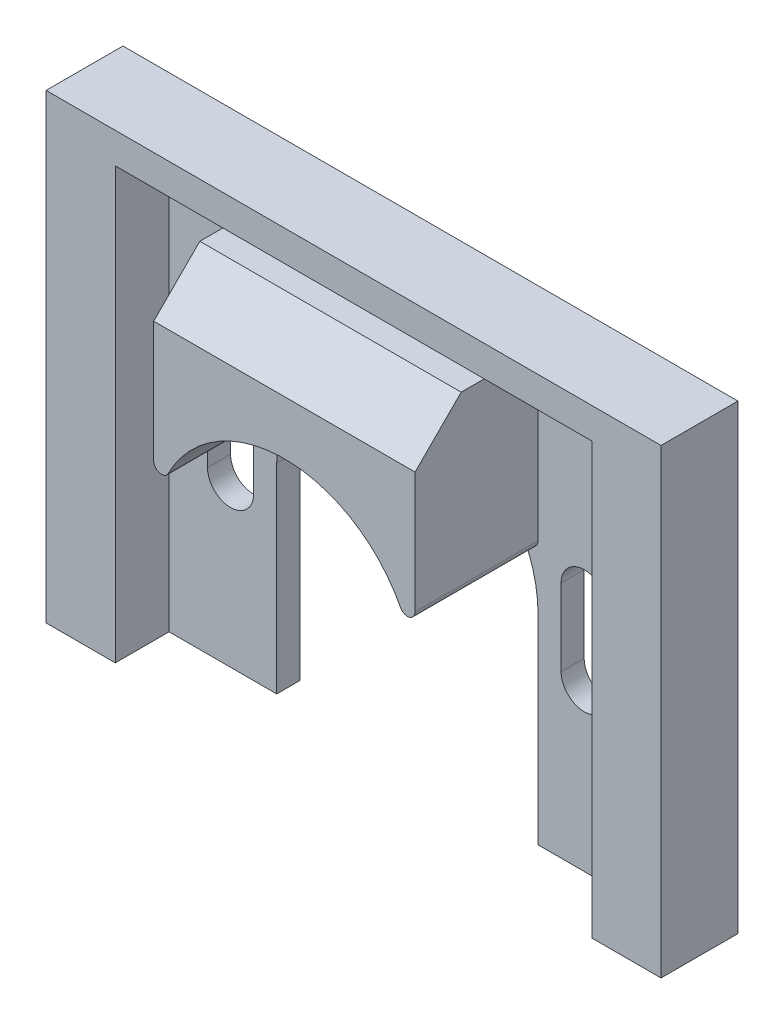
from build123d import *

# Parameters (mm, degrees)
SKETCH_1_W          = 40
SKETCH_1_H          = 30
EXTRUDE_1_DEPTH     = 5
SKETCH_2_W          = 31
SKETCH_2_H          = 28
CUT_EXTRUDE_1_DEPTH = 3.5
CUT_EXTRUDE_2_DEPTH = 26.243811123
EXTRUDE_START       = 8
EXTRUDE_2_DEPTH     = 8
FILLET_START        = 1.5
FILLET_1_DEPTH      = 8.5
CHAMFER_1_SIZE      = 3


with BuildPart() as part:
    # ｽｹｯﾁ1 → ﾎﾞｽ - 押し出し1 (new body)
    with BuildSketch(Plane.XY):
        Rectangle(SKETCH_1_W, SKETCH_1_H)
    extrude(amount=EXTRUDE_1_DEPTH)

    # ｽｹｯﾁ2 → ｶｯﾄ - 押し出し1 (cut)
    with BuildSketch(Plane.XY.offset(5)):
        with Locations((0, -1)):
            Rectangle(SKETCH_2_W, SKETCH_2_H)
    extrude(amount=-CUT_EXTRUDE_1_DEPTH, mode=Mode.SUBTRACT)

    # ｽｹｯﾁ3 → ｶｯﾄ - 押し出し2 (cut, through all)
    with BuildSketch(Plane.XY.offset(1.5)):
        with BuildLine():
            Line((8.5, -2), (8.5, -15))
            Line((8.5, -15), (-8.5, -15))
            Line((-8.5, -15), (-8.5, -2))
            ThreePointArc((-8.5, -2), (0, 6.5), (8.5, -2))
        make_face()
        with BuildLine():
            Line((13, -4.5), (13, 0.5))
            ThreePointArc((13, 0.5), (11.5, 2), (10, 0.5))
            Line((10, 0.5), (10, -4.5))
            ThreePointArc((10, -4.5), (11.5, -6), (13, -4.5))
        make_face()
        with BuildLine():
            Line((-13, -4.5), (-13, 0.5))
            ThreePointArc((-13, 0.5), (-11.5, 2), (-10, 0.5))
            Line((-10, 0.5), (-10, -4.5))
            ThreePointArc((-10, -4.5), (-11.5, -6), (-13, -4.5))
        make_face()
    extrude(amount=-CUT_EXTRUDE_2_DEPTH, mode=Mode.SUBTRACT)

    # ｽｹｯﾁ4 → ﾎﾞｽ - 押し出し2 (add)
    with BuildSketch(Plane.XY.offset(1.5).offset(EXTRUDE_START)):
        with BuildLine():
            Line((-8.5, -2), (-8.5, 13))
            Line((-8.5, 13), (8.5, 13))
            Line((8.5, 13), (8.5, -2))
            ThreePointArc((8.5, -2), (0, 6.5), (-8.5, -2))
        make_face()
    extrude(amount=-EXTRUDE_2_DEPTH)

    # ﾌｨﾚｯﾄ1: read off the stored shape, not the designer's step
    # ﾌｨﾚｯﾄ1 outline → ﾌｨﾚｯﾄ1 (cut)
    with BuildSketch(Plane.XY.offset(FILLET_START)):
        with BuildLine():
            ThreePointArc((8.5, 2.123105626), (8.117851131, 1.637192968), (7.555555556, 1.894044202))
            ThreePointArc((7.555555556, 1.894044202), (8.260515184, 0.003469213), (8.5, -2))
            Line((8.5, -2), (8.5, 2.123105626))
        make_face()
        with BuildLine():
            ThreePointArc((-7.555555556, 1.894044202), (-8.117851131, 1.637192968), (-8.5, 2.123105626))
            Line((-8.5, 2.123105626), (-8.5, -2))
            ThreePointArc((-8.5, -2), (-8.260515184, 0.003469213), (-7.555555556, 1.894044202))
        make_face()
    extrude(amount=FILLET_1_DEPTH, mode=Mode.SUBTRACT)

    # 面取り1
    chamfer_1_edges = [part.edges().sort_by_distance(p)[0] for p in [
        (0, 13, 9.5),
    ]]
    chamfer(chamfer_1_edges, length=CHAMFER_1_SIZE)


solid = part.part
